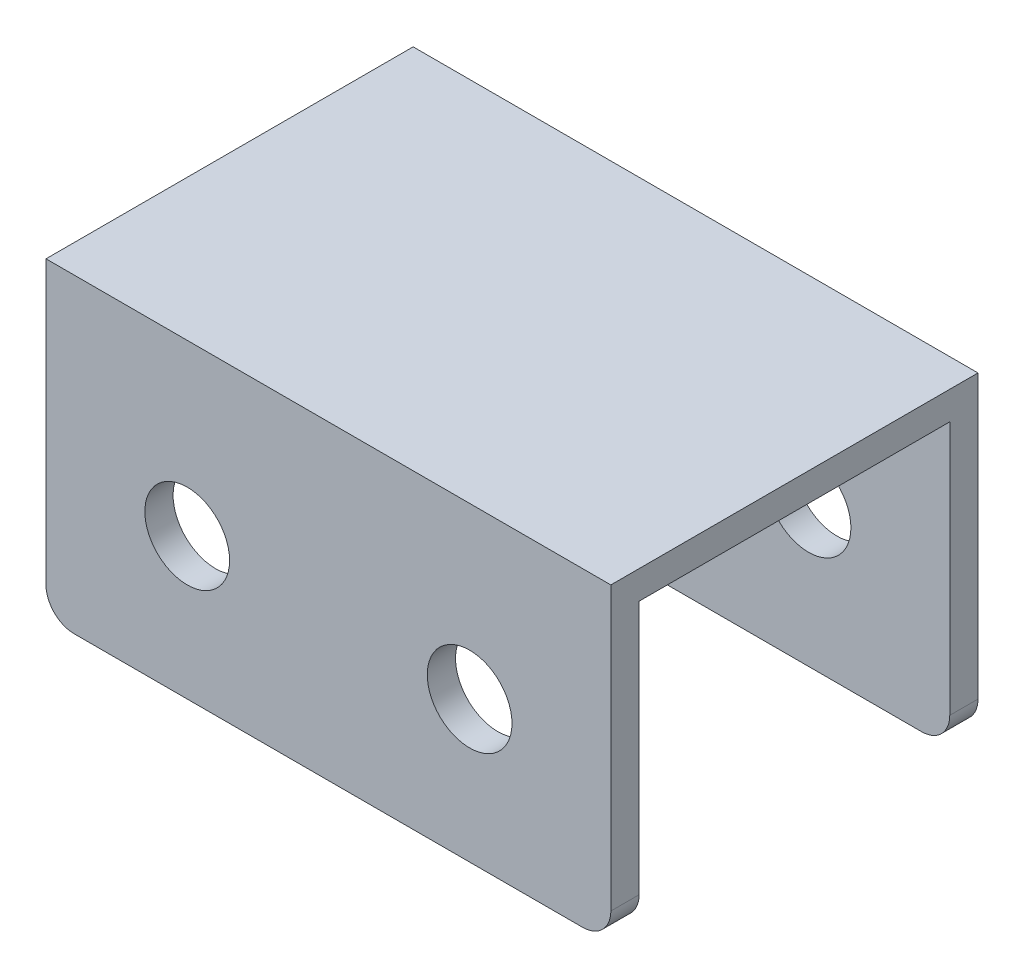
from build123d import *

# Parameters (mm, degrees)
EXTRUDE_THIN1_START       = -32.5
EXTRUDE_THIN1_OUTLINE_W   = 100
EXTRUDE_THIN1_OUTLINE_H   = 5
EXTRUDE_THIN1_DEPTH       = 65
EXTRUDE_THIN1_2_OUTLINE_W = 100
EXTRUDE_THIN1_2_OUTLINE_H = 50
EXTRUDE_THIN1_2_DEPTH     = 5
EXTRUDE_THIN1_START_2     = 27.5
EXTRUDE_THIN1_3_OUTLINE_W = 100
EXTRUDE_THIN1_3_OUTLINE_H = 50
EXTRUDE_THIN1_3_DEPTH     = 5
CUT_EXTRUDE1_DEPTH        = 78.821912081
CUT_EXTRUDE1_DEPTH_BACK   = 78.821912081
SKETCH2_R                 = 7.5
FILLET1_R                 = 5


# Read off the part's stored shape, not the designer's step: Extrude-Thin1
with BuildPart() as part:
    # Extrude-Thin1 outline → Extrude-Thin1 (new body)
    with BuildSketch(Plane.XY.offset(EXTRUDE_THIN1_START)):
        with Locations((0, 2.5)):
            Rectangle(EXTRUDE_THIN1_OUTLINE_W, EXTRUDE_THIN1_OUTLINE_H)
    extrude(amount=EXTRUDE_THIN1_DEPTH)

    # Extrude-Thin1 2 outline → Extrude-Thin1 2 (add)
    with BuildSketch(Plane.XY.offset(EXTRUDE_THIN1_START)):
        with Locations((0, -25)):
            Rectangle(EXTRUDE_THIN1_2_OUTLINE_W, EXTRUDE_THIN1_2_OUTLINE_H)
    extrude(amount=EXTRUDE_THIN1_2_DEPTH)

    # Extrude-Thin1 3 outline → Extrude-Thin1 3 (add)
    with BuildSketch(Plane.XY.offset(EXTRUDE_THIN1_START_2)):
        with Locations((0, -25)):
            Rectangle(EXTRUDE_THIN1_3_OUTLINE_W, EXTRUDE_THIN1_3_OUTLINE_H)
    extrude(amount=EXTRUDE_THIN1_3_DEPTH)

    # Sketch2 → Cut-Extrude1 (cut, two sides: drawn at the far end of the back side and taken through both)
    with BuildSketch(Plane.XY.offset(-CUT_EXTRUDE1_DEPTH_BACK)):
        with Locations((-25, -25)):
            Circle(SKETCH2_R)
        with Locations((25, -25)):
            Circle(SKETCH2_R)
    extrude(amount=CUT_EXTRUDE1_DEPTH + CUT_EXTRUDE1_DEPTH_BACK, mode=Mode.SUBTRACT)

    # Fillet1
    fillet1_edges = [part.edges().sort_by_distance(p)[0] for p in [
        (50, -50, 30),
        (50, -50, -30),
        (-50, -50, 30),
        (-50, -50, -30),
    ]]
    fillet(fillet1_edges, radius=FILLET1_R)


solid = part.part
